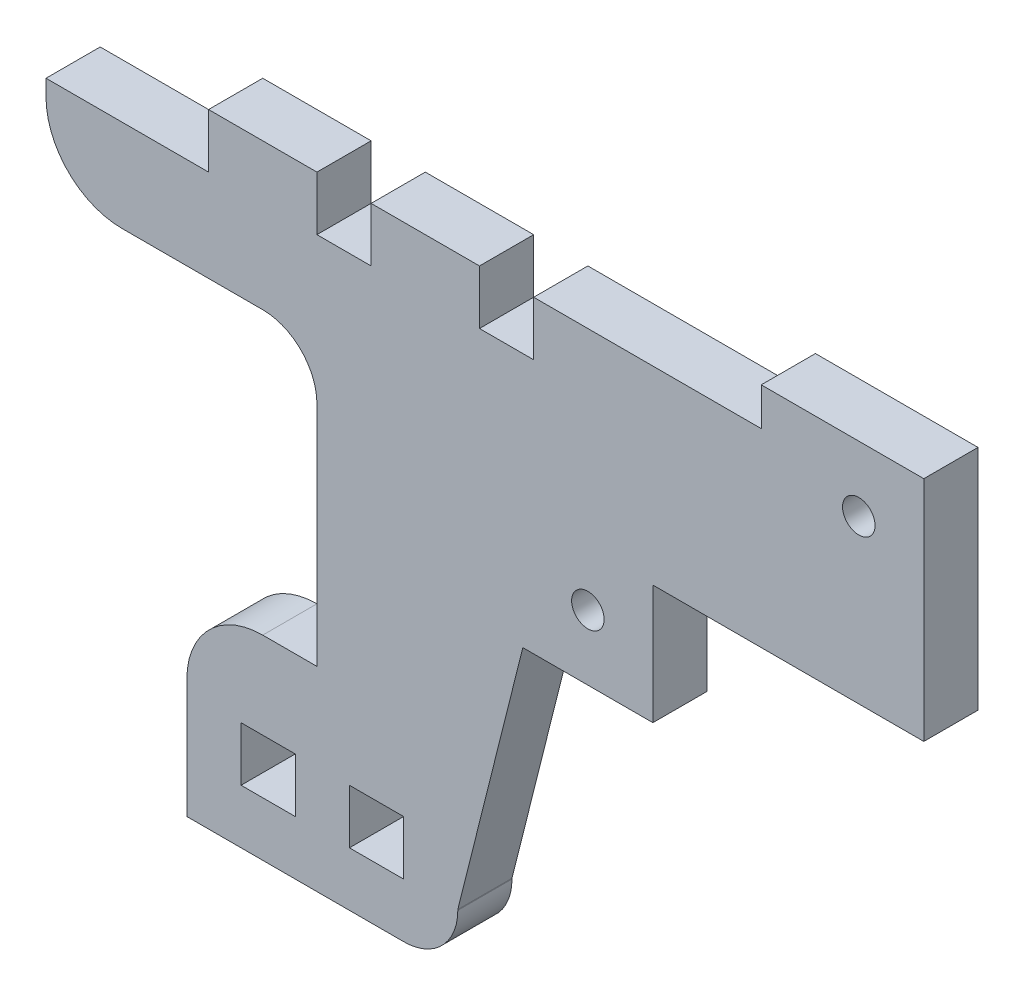
from build123d import *

# Parameters (mm, degrees)
ESQUISSE1_R        = 1.5
ESQUISSE1_W        = 5
ESQUISSE1_H        = 5
BOSS_EXTRU_1_DEPTH = 5
CONG_1_R           = 7
CONG_2_R           = 5
CONG_3_R           = 5


with BuildPart() as part:
    # Esquisse1 → Boss.-Extru.1 (new body)
    with BuildSketch(Plane.XY):
        Polygon((31, 19), (43, 19), (43, 30), (68, 30), (68, 51), (53, 51), (53, 47.5), (32, 47.5), (32, 42.5), (27, 42.5), (27, 47.5), (17, 47.5), (17, 42.5), (12, 42.5), (12, 47.5), (2, 47.5), (2, 42.5), (-13, 42.5), (-13, 34), (12, 34), (12, 8), (0, 8), (0, 0), (0, -5.810046935), (0, -10), (25, -10), (25, -4.928993292), align=None)
        with Locations((62, 45)):
            Circle(ESQUISSE1_R, mode=Mode.SUBTRACT)
        with Locations((37, 25)):
            Circle(ESQUISSE1_R, mode=Mode.SUBTRACT)
        with Locations((7.5, -2.5)):
            Rectangle(ESQUISSE1_W, ESQUISSE1_H, mode=Mode.SUBTRACT)
        with Locations((17.5, -2.5)):
            Rectangle(ESQUISSE1_W, ESQUISSE1_H, mode=Mode.SUBTRACT)
    extrude(amount=BOSS_EXTRU_1_DEPTH)

    # Congé1
    cong_1_edges = [part.edges().sort_by_distance(p)[0] for p in [
        (0, 8, 2.5),
        (-13, 34, 2.5),
    ]]
    fillet(cong_1_edges, radius=CONG_1_R)

    # Congé2
    cong_2_edges = [part.edges().sort_by_distance(p)[0] for p in [
        (12, 34, 2.5),
    ]]
    fillet(cong_2_edges, radius=CONG_2_R)

    # Congé3
    cong_3_edges = [part.edges().sort_by_distance(p)[0] for p in [
        (25, -10, 2.5),
    ]]
    fillet(cong_3_edges, radius=CONG_3_R)


solid = part.part
